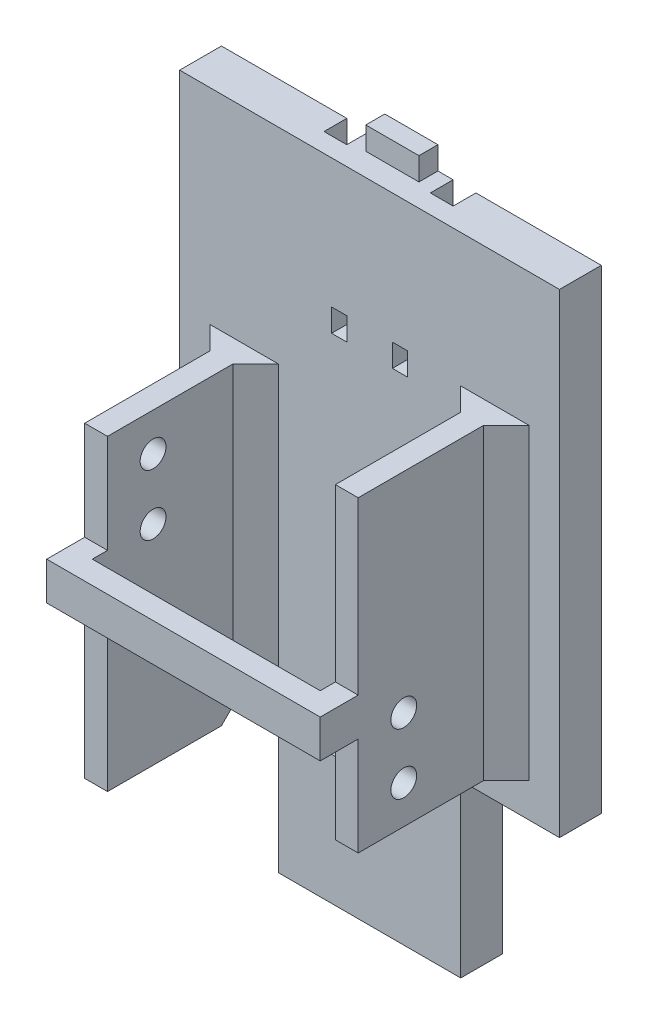
from build123d import *

# Parameters (mm, degrees)
CUT_EXTRUDE_START           = -3
CUT_EXTRUDE_1_DEPTH         = 0.5
CUT_EXTRUDE_START_2         = 127
CUT_EXTRUDE_1_2_DEPTH       = 3
CUT_EXTRUDE_START_3         = -172
CUT_EXTRUDE_1_3_DEPTH       = 8
SKETCH_2_W                  = 2.5
SKETCH_2_H                  = 0.5
EXTRUDE_1_DEPTH             = 0.5
SKETCH_3_W                  = 2.5
SKETCH_3_H                  = 0.5
EXTRUDE_2_DEPTH             = 5
EXTRUDE_3_DEPTH             = 0.5
EXTRUDE_4_DEPTH             = 36
EXTRUDE_5_DEPTH             = 35.5
EXTRUDE_6_DEPTH             = 9.5
SKETCH_8_W                  = 39
SKETCH_8_H                  = 5.5
EXTRUDE_7_DEPTH             = 17.5
SKETCH_9_W                  = 36
SKETCH_9_H                  = 2
CUT_EXTRUDE_2_DEPTH         = 22.5
SKETCH_10_W                 = 36
SKETCH_10_H                 = 2
CUT_EXTRUDE_3_DEPTH         = 22.5
SKETCH_11_W                 = 39
SKETCH_11_H                 = 5.5
EXTRUDE_8_DEPTH             = 22
SKETCH_12_W                 = 5.5
SKETCH_12_H                 = 62.5
EXTRUDE_9_DEPTH             = 4
CUT_EXTRUDE_4_DEPTH         = 9
SKETCH_14_W                 = 5.5
SKETCH_14_H                 = 85
EXTRUDE_10_DEPTH            = 7
CUT_EXTRUDE_5_DEPTH         = 30
SKETCH_16_W                 = 19.5
SKETCH_16_H                 = 9.5
CUT_EXTRUDE_6_DEPTH         = 6
CUT_EXTRUDE_7_DEPTH         = 27
CUT_EXTRUDE_8_DEPTH         = 3
SKETCH_19_W                 = 36
SKETCH_19_H                 = 5
EXTRUDE_11_DEPTH            = 3
CUT_EXTRUDE_9_DEPTH         = 3
SKETCH_21_W                 = 3
SKETCH_21_H                 = 3
CUT_EXTRUDE_10_DEPTH        = 195.334762716
CUT_EXTRUDE_11_DEPTH        = 3
SKETCH_23_W                 = 3
SKETCH_23_H                 = 3
CUT_EXTRUDE_12_DEPTH        = 195.334762716
CUT_EXTRUDE_13_DEPTH        = 3
CUT_EXTRUDE_14_REACH        = 198.85
SKETCH_25_W                 = 3
SKETCH_25_H                 = 3
CUT_EXTRUDE_15_DEPTH        = 3
CUT_EXTRUDE_16_REACH        = 198.85
SKETCH_27_W                 = 3
SKETCH_27_H                 = 3
SKETCH_28_W                 = 13
SKETCH_28_H                 = 22.5
CUT_EXTRUDE_17_DEPTH        = 262.880220712
SKETCH_29_W                 = 2
SKETCH_29_H                 = 3
CUT_EXTRUDE_18_DEPTH        = 262.307290369
SKETCH_30_W                 = 2
SKETCH_30_H                 = 3
CUT_EXTRUDE_19_DEPTH        = 262.307290369
SKETCH_31_W                 = 2
SKETCH_31_H                 = 3
CUT_EXTRUDE_20_DEPTH        = 262.307290369
SKETCH_32_W                 = 2
SKETCH_32_H                 = 3
CUT_EXTRUDE_21_DEPTH        = 262.880220712
SKETCH_33_W                 = 7
SKETCH_33_H                 = 2.5
EXTRUDE_12_DEPTH            = 3
SKETCH_34_W                 = 7
SKETCH_34_H                 = 2.5
EXTRUDE_13_DEPTH            = 3
SKETCH_35_W                 = 3
SKETCH_35_H                 = 3
CUT_EXTRUDE_22_DEPTH        = 6
SKETCH_36_W                 = 3
SKETCH_36_H                 = 3
CUT_EXTRUDE_23_DEPTH        = 6
SKETCH_37_W                 = 3
SKETCH_37_H                 = 3
CUT_EXTRUDE_24_DEPTH        = 6
SKETCH_38_W                 = 3
SKETCH_38_H                 = 3
CUT_EXTRUDE_25_DEPTH        = 6
HOLE_WIZARD_3_4_3_4_1_D     = 3.4
HOLE_WIZARD_3_4_3_4_1_DEPTH = 3
HOLE_WIZARD_3_4_3_4_2_D     = 3.4
HOLE_WIZARD_3_4_3_4_2_DEPTH = 3
CHAMFER_1_SIZE              = 3
CHAMFER_2_SIZE              = 0.40824829
FILLET_2_R                  = 2


with BuildPart() as part:
    # 切除-拉伸1: read off the stored shape, not the designer's step
    # 切除-拉伸1 outline → 切除-拉伸1 (new body)
    with BuildSketch(Plane(origin=(-168, 0, 0), x_dir=(0, 0, -1), z_dir=(1, 0, 0)).offset(CUT_EXTRUDE_START)):
        Polygon((-5, 130), (-5.5, 130), (-5.5, 129.5), align=None)
    extrude(amount=CUT_EXTRUDE_1_DEPTH)

    # Cut-Extrude 1 2 outline → Cut-Extrude 1 2 (add)
    with BuildSketch(Plane(origin=(0, 0, 0), x_dir=(1, 0, 0), z_dir=(0, 1, 0)).offset(CUT_EXTRUDE_START_2)):
        Polygon((-171, -5.5), (-168, -8.5), (-168, -5.5), align=None)
    extrude(amount=CUT_EXTRUDE_1_2_DEPTH)

    # Cut-Extrude 1 3 outline → Cut-Extrude 1 3 (cut)
    with BuildSketch(Plane(origin=(0, 0, 0), x_dir=(0.8164965809277257, 0.4082482904638635, -0.4082482904638629), z_dir=(0.5773502691896261, -0.5773502691896261, 0.5773502691896253)).offset(CUT_EXTRUDE_START_3)):
        Polygon((-85, 95.45941546), (-88.589879031, 95.45941546), (-88.794003176, 95.812968851), (-90.018748047, 93.691648507), (-90.995421768, 92), (-85, 92), align=None)
    extrude(amount=CUT_EXTRUDE_1_3_DEPTH, mode=Mode.SUBTRACT)

    # 草图2 → 凸台-拉伸1 (add)
    with BuildSketch(Plane(origin=(0, 0, 5.5), x_dir=(-1, 0, 0), z_dir=(0, 0, -1))):
        with Locations((169.25, 129.75)):
            Rectangle(SKETCH_2_W, SKETCH_2_H)
    extrude(amount=EXTRUDE_1_DEPTH)

    # 草图3 → 凸台-拉伸2 (add)
    with BuildSketch(Plane(origin=(0, 0, 5), x_dir=(-1, 0, 0), z_dir=(0, 0, -1))):
        with Locations((169.25, 129.75)):
            Rectangle(SKETCH_3_W, SKETCH_3_H)
    extrude(amount=EXTRUDE_2_DEPTH)

    # 草图4 → 凸台-拉伸3 (add)
    with BuildSketch(Plane.ZY.offset(170.5)):
        Polygon((0, 130), (5, 130), (5.5, 129.5), (0, 129.5), align=None)
    extrude(amount=EXTRUDE_3_DEPTH)

    # 草图5 → 凸台-拉伸4 (add)
    with BuildSketch(Plane(origin=(-168, 0, 0), x_dir=(0, 0, -1), z_dir=(1, 0, 0))):
        Polygon((0, 130), (0, 129.5), (-5.5, 129.5), (-10, 125), (-27, 125), (-27, 130), align=None)
    extrude(amount=EXTRUDE_4_DEPTH)

    # 草图6 → 凸台-拉伸5 (add)
    with BuildSketch(Plane(origin=(0, 130, 0), x_dir=(-1, 0, 0), z_dir=(0, 1, 0))):
        Polygon((168, 8.5), (171, 5.5), (171, 0), (132, 0), (132, 27), (168, 27), align=None)
    extrude(amount=EXTRUDE_5_DEPTH)

    # 草图7 → 凸台-拉伸6 (add)
    with BuildSketch(Plane(origin=(0, 165.5, 0), x_dir=(-1, 0, 0), z_dir=(0, 1, 0))):
        Polygon((132, 0), (132, 27), (168, 27), (168, 5.5), (171, 5.5), (171, 0), align=None)
    extrude(amount=EXTRUDE_6_DEPTH)

    # 草图8 → 凸台-拉伸7 (add)
    with BuildSketch(Plane(origin=(0, 175, 0), x_dir=(-1, 0, 0), z_dir=(0, 1, 0))):
        with Locations((151.5, 2.75)):
            Rectangle(SKETCH_8_W, SKETCH_8_H)
    extrude(amount=EXTRUDE_7_DEPTH)

    # 草图9 → 切除-拉伸2 (cut)
    with BuildSketch(Plane.XZ.offset(-125)):
        with Locations((-150, 26)):
            Rectangle(SKETCH_9_W, SKETCH_9_H)
    extrude(amount=-CUT_EXTRUDE_2_DEPTH, mode=Mode.SUBTRACT)

    # 草图10 → 切除-拉伸3 (cut)
    with BuildSketch(Plane(origin=(0, 175, 0), x_dir=(-1, 0, 0), z_dir=(0, 1, 0))):
        with Locations((150, 26)):
            Rectangle(SKETCH_10_W, SKETCH_10_H)
    extrude(amount=-CUT_EXTRUDE_3_DEPTH, mode=Mode.SUBTRACT)

    # 草图11 → 凸台-拉伸8 (add)
    with BuildSketch(Plane.XZ.offset(-129.5)):
        with Locations((-151.5, 2.75)):
            Rectangle(SKETCH_11_W, SKETCH_11_H)
    extrude(amount=EXTRUDE_8_DEPTH)

    # 草图12 → 凸台-拉伸9 (add)
    with BuildSketch(Plane.ZY.offset(171)):
        with Locations((2.75, 161.25)):
            Rectangle(SKETCH_12_W, SKETCH_12_H)
    extrude(amount=EXTRUDE_9_DEPTH)

    # 草图13 → 切除-拉伸4 (cut)
    with BuildSketch(Plane.ZY.offset(171)):
        Polygon((0, 130), (0, 107.5), (5.5, 107.5), (5.5, 129.5), (5, 130), align=None)
    extrude(amount=-CUT_EXTRUDE_4_DEPTH, mode=Mode.SUBTRACT)

    # 草图14 → 凸台-拉伸10 (add)
    with BuildSketch(Plane(origin=(-132, 0, 0), x_dir=(0, 0, -1), z_dir=(1, 0, 0))):
        with Locations((-2.75, 150)):
            Rectangle(SKETCH_14_W, SKETCH_14_H)
    extrude(amount=EXTRUDE_10_DEPTH)

    # 草图15 → 切除-拉伸5 (cut)
    with BuildSketch(Plane(origin=(-132, 0, 0), x_dir=(0, 0, -1), z_dir=(1, 0, 0))):
        Polygon((-5.5, 134.5), (-25, 134.5), (-25, 125), (-10, 125), (-5.5, 129.5), align=None)
    extrude(amount=-CUT_EXTRUDE_5_DEPTH, mode=Mode.SUBTRACT)

    # 草图16 → 切除-拉伸6 (cut)
    with BuildSketch(Plane.ZY.offset(168)):
        with Locations((15.25, 170.25)):
            Rectangle(SKETCH_16_W, SKETCH_16_H)
    extrude(amount=-CUT_EXTRUDE_6_DEPTH, mode=Mode.SUBTRACT)

    # 草图17 → 切除-拉伸7 (cut)
    with BuildSketch(Plane.ZY.offset(162)):
        Polygon((25, 134.5), (25, 147.5), (27, 147.5), (27, 152.5), (25, 152.5), (25, 175), (5.5, 175), (5.5, 134.5), align=None)
    extrude(amount=-CUT_EXTRUDE_7_DEPTH, mode=Mode.SUBTRACT)

    # 草图18 → 切除-拉伸8 (cut)
    with BuildSketch(Plane(origin=(-162, 0, 0), x_dir=(0, 0, -1), z_dir=(1, 0, 0))):
        Polygon((-10, 125), (-5.5, 129.5), (-5.5, 165.5), (-25, 165.5), (-25, 152.5), (-27, 152.5), (-27, 147.5), (-25, 147.5), (-25, 125), align=None)
    extrude(amount=-CUT_EXTRUDE_8_DEPTH, mode=Mode.SUBTRACT)

    # 草图19 → 凸台-拉伸11 (add)
    with BuildSketch(Plane.XY.offset(27)):
        with Locations((-150, 150)):
            Rectangle(SKETCH_19_W, SKETCH_19_H)
    extrude(amount=EXTRUDE_11_DEPTH)

    # 草图20 → 切除-拉伸9 (cut)
    with BuildSketch(Plane(origin=(0, 116.5, 0), x_dir=(1, 0, 0), z_dir=(0, 1, 0))):
        Polygon((-145.857883832, 0), (-145.857883832, -3.15), (-143, -4.8), (-140.142116168, -3.15), (-140.142116168, 0), align=None)
    extrude(amount=-CUT_EXTRUDE_9_DEPTH, mode=Mode.SUBTRACT)

    # 草图21 → 切除-拉伸10 (cut, through all)
    with BuildSketch(Plane(origin=(0, 113.5, 0), x_dir=(-1, 0, 0), z_dir=(0, 1, 0))):
        with Locations((143, 1.5)):
            Rectangle(SKETCH_21_W, SKETCH_21_H)
    extrude(amount=-CUT_EXTRUDE_10_DEPTH, mode=Mode.SUBTRACT)

    # 草图22 → 切除-拉伸11 (cut)
    with BuildSketch(Plane(origin=(0, 116.5, 0), x_dir=(1, 0, 0), z_dir=(0, 1, 0))):
        Polygon((-159.857883832, 0), (-159.857883832, -3.15), (-157, -4.8), (-154.142116168, -3.15), (-154.142116168, 0), align=None)
    extrude(amount=-CUT_EXTRUDE_11_DEPTH, mode=Mode.SUBTRACT)

    # 草图23 → 切除-拉伸12 (cut, through all)
    with BuildSketch(Plane(origin=(0, 113.5, 0), x_dir=(-1, 0, 0), z_dir=(0, 1, 0))):
        with Locations((157, 1.5)):
            Rectangle(SKETCH_23_W, SKETCH_23_H)
    extrude(amount=-CUT_EXTRUDE_12_DEPTH, mode=Mode.SUBTRACT)

    # 草图24 → 切除-拉伸13 (cut)
    with BuildSketch(Plane.XZ.offset(-183.5)):
        Polygon((-145.857883832, 0), (-140.142116168, 0), (-140.142116168, 3.15), (-143, 4.8), (-145.857883832, 3.15), align=None)
    extrude(amount=-CUT_EXTRUDE_13_DEPTH, mode=Mode.SUBTRACT)

    # 草图25 → 切除-拉伸14 (cut, up to next)
    with BuildSketch(Plane(origin=(0, 192.5, 0), x_dir=(-1, 0, 0), z_dir=(0, 1, 0)), mode=Mode.PRIVATE) as cut_extrude_14_sk1:
        with Locations((143, 1.5)):
            Rectangle(SKETCH_25_W, SKETCH_25_H)
    cut_extrude_14_tool1 = extrude(cut_extrude_14_sk1.sketch, amount=-CUT_EXTRUDE_14_REACH, mode=Mode.PRIVATE) & part.part
    add(cut_extrude_14_tool1.solids().sort_by_distance((-143, 192.5, 1.5))[0], mode=Mode.SUBTRACT)

    # 草图26 → 切除-拉伸15 (cut)
    with BuildSketch(Plane.XZ.offset(-183.5)):
        Polygon((-159.857883832, 0), (-154.142116168, 0), (-154.142116168, 3.15), (-157, 4.8), (-159.857883832, 3.15), align=None)
    extrude(amount=-CUT_EXTRUDE_15_DEPTH, mode=Mode.SUBTRACT)

    # 草图27 → 切除-拉伸16 (cut, up to next)
    with BuildSketch(Plane(origin=(0, 192.5, 0), x_dir=(-1, 0, 0), z_dir=(0, 1, 0)), mode=Mode.PRIVATE) as cut_extrude_16_sk1:
        with Locations((157, 1.5)):
            Rectangle(SKETCH_27_W, SKETCH_27_H)
    cut_extrude_16_tool1 = extrude(cut_extrude_16_sk1.sketch, amount=-CUT_EXTRUDE_16_REACH, mode=Mode.PRIVATE) & part.part
    add(cut_extrude_16_tool1.solids().sort_by_distance((-157, 192.5, 1.5))[0], mode=Mode.SUBTRACT)

    # 草图28 → 切除-拉伸17 (cut, through all)
    with BuildSketch(Plane(origin=(0, 0, 0), x_dir=(-1, 0, 0), z_dir=(0, 0, -1))):
        with Locations((131.5, 118.75)):
            Rectangle(SKETCH_28_W, SKETCH_28_H)
    extrude(amount=-CUT_EXTRUDE_17_DEPTH, mode=Mode.SUBTRACT)

    # 草图29 → 切除-拉伸18 (cut, through all)
    with BuildSketch(Plane.XY.offset(5.5)):
        with Locations((-154, 174)):
            Rectangle(SKETCH_29_W, SKETCH_29_H)
    extrude(amount=-CUT_EXTRUDE_18_DEPTH, mode=Mode.SUBTRACT)

    # 草图30 → 切除-拉伸19 (cut, through all)
    with BuildSketch(Plane.XY.offset(5.5)):
        with Locations((-146, 174)):
            Rectangle(SKETCH_30_W, SKETCH_30_H)
    extrude(amount=-CUT_EXTRUDE_19_DEPTH, mode=Mode.SUBTRACT)

    # 草图31 → 切除-拉伸20 (cut, through all)
    with BuildSketch(Plane.XY.offset(5.5)):
        with Locations((-154, 126)):
            Rectangle(SKETCH_31_W, SKETCH_31_H)
    extrude(amount=-CUT_EXTRUDE_20_DEPTH, mode=Mode.SUBTRACT)

    # 草图32 → 切除-拉伸21 (cut, through all)
    with BuildSketch(Plane(origin=(0, 0, 0), x_dir=(-1, 0, 0), z_dir=(0, 0, -1))):
        with Locations((146, 126)):
            Rectangle(SKETCH_32_W, SKETCH_32_H)
    extrude(amount=-CUT_EXTRUDE_21_DEPTH, mode=Mode.SUBTRACT)

    # 草图33 → 凸台-拉伸12 (add)
    with BuildSketch(Plane.XZ.offset(-107.5)):
        with Locations((-150, 1.25)):
            Rectangle(SKETCH_33_W, SKETCH_33_H)
    extrude(amount=EXTRUDE_12_DEPTH)

    # 草图34 → 凸台-拉伸13 (add)
    with BuildSketch(Plane(origin=(0, 192.5, 0), x_dir=(-1, 0, 0), z_dir=(0, 1, 0))):
        with Locations((150, 1.25)):
            Rectangle(SKETCH_34_W, SKETCH_34_H)
    extrude(amount=EXTRUDE_13_DEPTH)

    # 草图35 → 切除-拉伸22 (cut)
    with BuildSketch(Plane.XZ.offset(-116.5)):
        with Locations((-143, 1.5)):
            Rectangle(SKETCH_35_W, SKETCH_35_H)
    extrude(amount=-CUT_EXTRUDE_22_DEPTH, mode=Mode.SUBTRACT)

    # 草图36 → 切除-拉伸23 (cut)
    with BuildSketch(Plane.XZ.offset(-116.5)):
        with Locations((-157, 1.5)):
            Rectangle(SKETCH_36_W, SKETCH_36_H)
    extrude(amount=-CUT_EXTRUDE_23_DEPTH, mode=Mode.SUBTRACT)

    # 草图37 → 切除-拉伸24 (cut)
    with BuildSketch(Plane(origin=(0, 183.5, 0), x_dir=(-1, 0, 0), z_dir=(0, 1, 0))):
        with Locations((143, 1.5)):
            Rectangle(SKETCH_37_W, SKETCH_37_H)
    extrude(amount=-CUT_EXTRUDE_24_DEPTH, mode=Mode.SUBTRACT)

    # 草图38 → 切除-拉伸25 (cut)
    with BuildSketch(Plane(origin=(0, 183.5, 0), x_dir=(-1, 0, 0), z_dir=(0, 1, 0))):
        with Locations((157, 1.5)):
            Rectangle(SKETCH_38_W, SKETCH_38_H)
    extrude(amount=-CUT_EXTRUDE_25_DEPTH, mode=Mode.SUBTRACT)

    # Ø3.4 (3.4) 直径孔1
    with Locations(Plane.ZY.offset(168)):
        with Locations((19, 152.5), (19, 160.5)):
            Hole(HOLE_WIZARD_3_4_3_4_1_D / 2, depth=HOLE_WIZARD_3_4_3_4_1_DEPTH)

    # Ø3.4 (3.4) 直径孔2
    with Locations(Plane(origin=(-132, 0, 0), x_dir=(0, 0, -1), z_dir=(1, 0, 0))):
        with Locations((-19, 147.5), (-19, 139.5)):
            Hole(HOLE_WIZARD_3_4_3_4_2_D / 2, depth=HOLE_WIZARD_3_4_3_4_2_DEPTH)

    # 倒角1
    chamfer_1_edges = [part.edges().sort_by_distance(p)[0] for p in [
        (-135, 154.75, 5.5),
        (-132, 154.75, 5.5),
        (-165, 147.5, 5.5),
    ]]
    chamfer(chamfer_1_edges, length=CHAMFER_1_SIZE)

    # 倒角2
    chamfer_2_edges = [part.edges().sort_by_distance(p)[0] for p in [
        (-163.5, 128, 7),
    ]]
    chamfer(chamfer_2_edges, length=CHAMFER_2_SIZE)

    # 圆角2
    fillet_2_edges = [part.edges().sort_by_distance(p)[0] for p in [
        (-166.5, 147.5, 25),
    ]]
    fillet(fillet_2_edges, radius=FILLET_2_R)


solid = part.part
